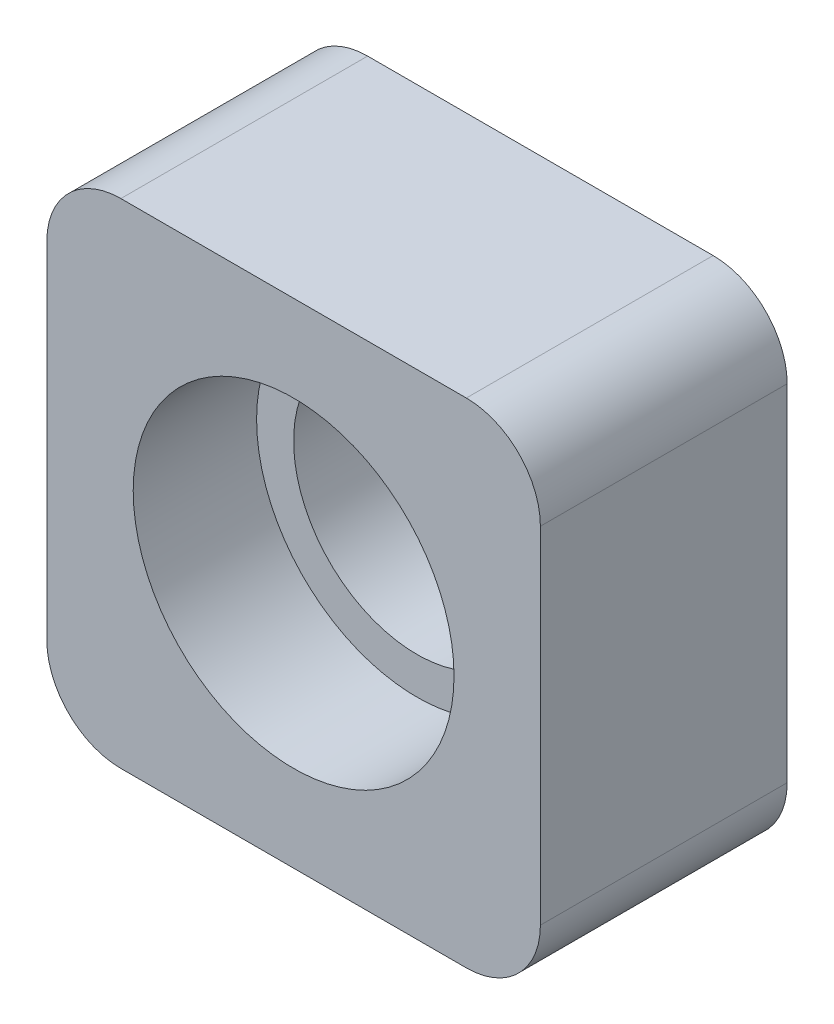
from build123d import *

# Parameters (mm, degrees)
SKETCH1_W           = 20
SKETCH1_H           = 20
BOSS_EXTRUDE1_DEPTH = 5
FILLET1_R           = 3
CUT_EXTRUDE1_REACH  = 19.321
SKETCH2_R           = 5
SKETCH3_R           = 6.5
CUT_EXTRUDE2_DEPTH  = 5


with BuildPart() as part:
    # Sketch1 → Boss-Extrude1 (new, symmetric)
    with BuildSketch(Plane.XY):
        Rectangle(SKETCH1_W, SKETCH1_H)
    extrude(amount=BOSS_EXTRUDE1_DEPTH, both=True)

    # Fillet1
    fillet1_edges = [part.edges().sort_by_distance(p)[0] for p in [
        (-10, -10, 0),
        (10, -10, 0),
        (-10, 10, 0),
        (10, 10, 0),
    ]]
    fillet(fillet1_edges, radius=FILLET1_R)

    # Sketch2 → Cut-Extrude1 (cut, up to next)
    with BuildSketch(Plane.XY.offset(5), mode=Mode.PRIVATE) as cut_extrude1_sk1:
        Circle(SKETCH2_R)
    cut_extrude1_tool1 = extrude(cut_extrude1_sk1.sketch, amount=-CUT_EXTRUDE1_REACH, mode=Mode.PRIVATE) & part.part
    add(cut_extrude1_tool1.solids().sort_by_distance((0, 0, 5))[0], mode=Mode.SUBTRACT)

    # Sketch3 → Cut-Extrude2 (cut)
    with BuildSketch(Plane.XY.offset(5)):
        Circle(SKETCH3_R)
    extrude(amount=-CUT_EXTRUDE2_DEPTH, mode=Mode.SUBTRACT)


solid = part.part
